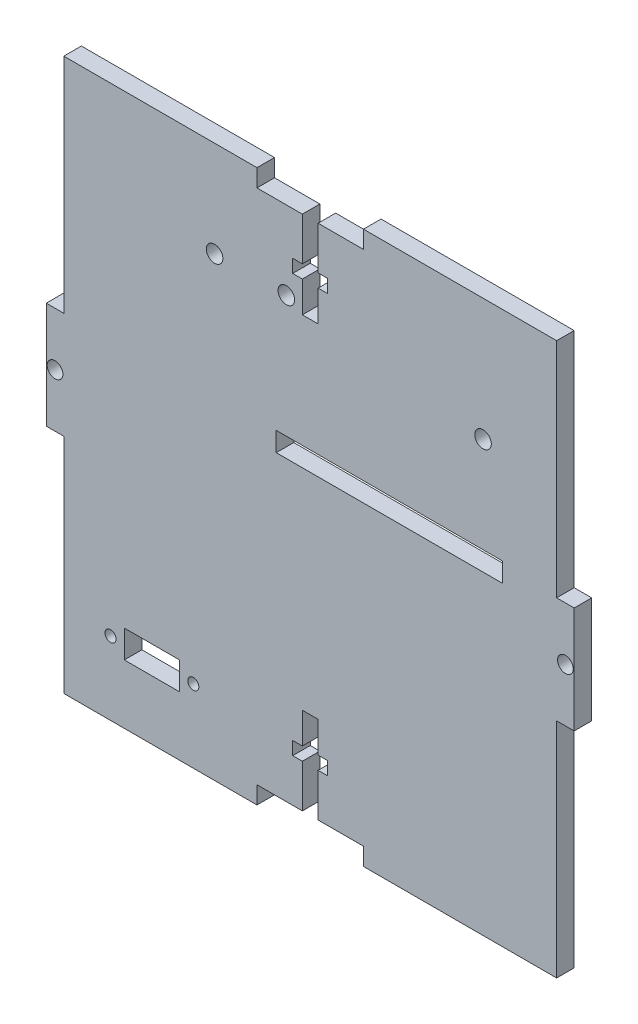
from build123d import *

# Parameters (mm, degrees)
BOSS_EXTRUDE1_DEPTH = 3.18
SKETCH18_W          = 3.18
SKETCH18_H          = 19.3
BOSS_EXTRUDE8_DEPTH = 3.18
SKETCH19_R          = 1.425
CUT_EXTRUDE8_DEPTH  = 70.262854583
CUT_EXTRUDE13_DEPTH = 70.262854583
SKETCH31_R          = 1.5
SKETCH31_W          = 41
SKETCH31_H          = 3.5
CUT_EXTRUDE16_DEPTH = 70.262854583
SKETCH36_R          = 1
SKETCH36_W          = 10
SKETCH36_H          = 5
CUT_EXTRUDE27_DEPTH = 70.262854583


with BuildPart() as part:
    # Sketch1 → Boss-Extrude1 (new body)
    with BuildSketch(Plane.XY):
        Polygon((-44.645, 50), (-14.881666667, 50), (14.881666667, 50), (44.645, 50), (44.645, -50), (-44.645, -50), align=None)
    extrude(amount=BOSS_EXTRUDE1_DEPTH)

    # Sketch18 → Boss-Extrude8 (add)
    with BuildSketch(Plane(origin=(44.645, 0, 0), x_dir=(0, 0, -1), z_dir=(1, 0, 0))):
        with Locations((-1.59, 0)):
            Rectangle(SKETCH18_W, SKETCH18_H)
    boss_extrude8 = extrude(amount=BOSS_EXTRUDE8_DEPTH)

    # Sketch19 → Cut-Extrude8 (cut, through all)
    with BuildSketch(Plane.XY.offset(3.18)):
        with Locations((46.235, 0)):
            Circle(SKETCH19_R)
    cut_extrude8 = extrude(amount=-CUT_EXTRUDE8_DEPTH, mode=Mode.SUBTRACT)

    # Mirror2: Boss-Extrude8, Cut-Extrude8 across plane
    add(boss_extrude8.mirror(Plane(origin=(0, 0, 0), x_dir=(0, 0, 1), z_dir=(1, 0, 0))))
    add(cut_extrude8.mirror(Plane(origin=(0, 0, 0), x_dir=(0, 0, 1), z_dir=(1, 0, 0))), mode=Mode.SUBTRACT)

    # Sketch26 → Cut-Extrude13 (cut, through all)
    with BuildSketch(Plane.XY.offset(3.18)):
        Polygon((-9.65, 50), (9.65, 50), (9.65, 46.82), (1.425, 46.82), (1.425, 39.02), (3.175, 39.02), (3.175, 36.64), (1.425, 36.64), (1.425, 31.02), (-1.425, 31.02), (-1.425, 36.64), (-3.175, 36.64), (-3.175, 39.02), (-1.425, 39.02), (-1.425, 46.82), (-9.65, 46.82), align=None)
    cut_extrude13 = extrude(amount=-CUT_EXTRUDE13_DEPTH, mode=Mode.SUBTRACT)

    # Mirror7: Cut-Extrude13 across plane
    add(cut_extrude13.mirror(Plane.ZX), mode=Mode.SUBTRACT)

    # Sketch31 → Cut-Extrude16 (cut, through all)
    with BuildSketch(Plane.XY.offset(3.18)):
        with Locations((-17.325, 32.65)):
            Circle(SKETCH31_R)
        with Locations((31.306146823, 27.864159796)):
            Circle(SKETCH31_R)
        with Locations((-4.325, 32.65)):
            Circle(SKETCH31_R)
        with Locations((14.3410024, 8.774159796)):
            Rectangle(SKETCH31_W, SKETCH31_H)
    extrude(amount=-CUT_EXTRUDE16_DEPTH, mode=Mode.SUBTRACT)

    # Sketch36 → Cut-Extrude27 (cut, through all)
    with BuildSketch(Plane.XY.offset(3.18)):
        with Locations((-21.181648121, -36.756808674)):
            Circle(SKETCH36_R)
        with Locations((-36.181648121, -36.756808674)):
            Circle(SKETCH36_R)
        with Locations((-28.681648121, -36.756808674)):
            Rectangle(SKETCH36_W, SKETCH36_H)
    extrude(amount=-CUT_EXTRUDE27_DEPTH, mode=Mode.SUBTRACT)


solid = part.part
